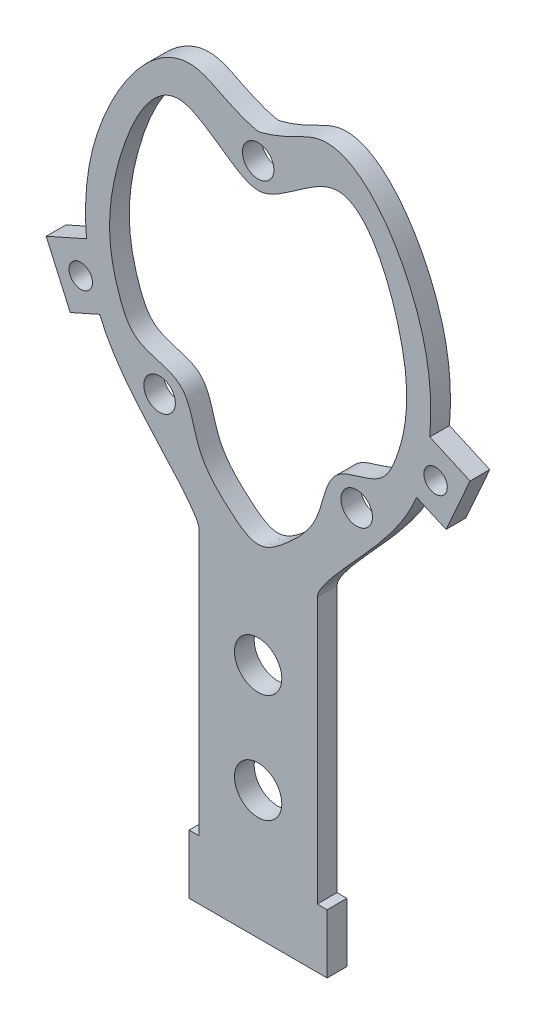
from build123d import *

# Parameters (mm, degrees)
SKETCH2_R           = 1.2
SKETCH2_R_2         = 0.8
BOSS_EXTRUDE2_DEPTH = 1
BOSS_EXTRUDE3_DEPTH = 1
SKETCH4_R           = 0.594999999
CUT_EXTRUDE10_DEPTH = 10


with BuildPart() as part:
    # Sketch2 → Boss-Extrude2 (new body)
    with BuildSketch(Plane.XY):
        with BuildLine():
            Line((-3, -25.6), (-3.5, -25.6))
            Line((-3.5, -25.6), (-3.5, -28.6))
            Line((-3.5, -28.6), (3.5, -28.6))
            Line((3.5, -28.6), (3.5, -25.6))
            Line((3.5, -25.6), (3, -25.6))
            Line((3, -25.6), (3, -12.1))
            add(Edge.make_bspline(
                [(3, -12.1), (3.058103828, -11.435870201), (7.372156419, -7.261735624), (8.816301548, -3.819636641), (8.795211315, 3.088220748), (4.729906031, 9.502714417), (1.543138013, 7.285247455), (0.138381747, 6.848730149), (-0.138381747, 6.848730149), (-1.543138013, 7.285247455), (-4.729906031, 9.502714417), (-8.795211315, 3.088220748), (-8.816301548, -3.819636641), (-7.372156419, -7.261735624), (-3.058103828, -11.435870201), (-3, -12.1)],
                knots=[0.110531839, 0.110531839, 0.110531839, 0.110531839, 0.195870509, 0.310871915, 0.375079995, 0.502014152, 0.537662278, 0.553505555, 0.557026284, 0.572869561, 0.608517687, 0.735451844, 0.799659924, 0.91466133, 1, 1, 1, 1], degree=3))
            Line((-3, -12.1), (-3, -25.6))
        make_face()
        with Locations((0, -16.6)):
            Circle(SKETCH2_R, mode=Mode.SUBTRACT)
        with Locations((0, 5.55)):
            Circle(SKETCH2_R_2, mode=Mode.SUBTRACT)
        with Locations((-5, -7.2)):
            Circle(SKETCH2_R_2, mode=Mode.SUBTRACT)
        with Locations((5, -7.2)):
            Circle(SKETCH2_R_2, mode=Mode.SUBTRACT)
        with Locations((0, -22.1)):
            Circle(SKETCH2_R, mode=Mode.SUBTRACT)
        with BuildLine():
            add(Edge.make_bspline(
                [(0, 4.25), (-0.417612959, 4.25), (-1.806909343, 5.016290019), (-4.901204561, 7.754060047), (-7.771028928, 1.128148542), (-7.631282508, -2.661392118), (-6.25678999, -5.757950433), (-3.501481263, -5.76089978), (-3.230109482, -8.784428483), (-1.74530404, -10.314020364), (0, -11.677388837), (1.74530404, -10.314020364), (3.230109482, -8.784428483), (3.501481263, -5.76089978), (6.25678999, -5.757950433), (7.631282508, -2.661392118), (7.771028928, 1.128148542), (4.901204561, 7.754060047), (1.806909343, 5.016290019), (0.417612959, 4.25), (0, 4.25)],
                knots=[0, 0, 0, 0, 0.025607361, 0.08518944, 0.194127412, 0.298810242, 0.326537395, 0.373370364, 0.421073963, 0.469790648, 0.5, 0.530209352, 0.578926037, 0.626629636, 0.673462605, 0.701189758, 0.805872588, 0.91481056, 0.974392639, 1, 1, 1, 1], degree=3))
        make_face(mode=Mode.SUBTRACT)
    extrude(amount=BOSS_EXTRUDE2_DEPTH)

    # Sketch3 → Boss-Extrude3 (add)
    with BuildSketch(Plane.XY):
        Polygon((-6.791190485, -4.658529061), (-8.011400414, -1.917892688), (-10.752036787, -3.138102617), (-9.531826857, -5.87873899), align=None)
        Polygon((8.011400414, -1.917892688), (6.791190485, -4.658529061), (9.531826857, -5.87873899), (10.752036787, -3.138102617), align=None)
    extrude(amount=BOSS_EXTRUDE3_DEPTH)

    # Sketch4 → Cut-Extrude10 (cut)
    with BuildSketch(Plane.XY):
        with Locations((-8.999999996, -4.000000008)):
            Circle(SKETCH4_R)
        with Locations((8.999999996, -4.000000008)):
            Circle(SKETCH4_R)
    extrude(amount=CUT_EXTRUDE10_DEPTH, mode=Mode.SUBTRACT)


solid = part.part
